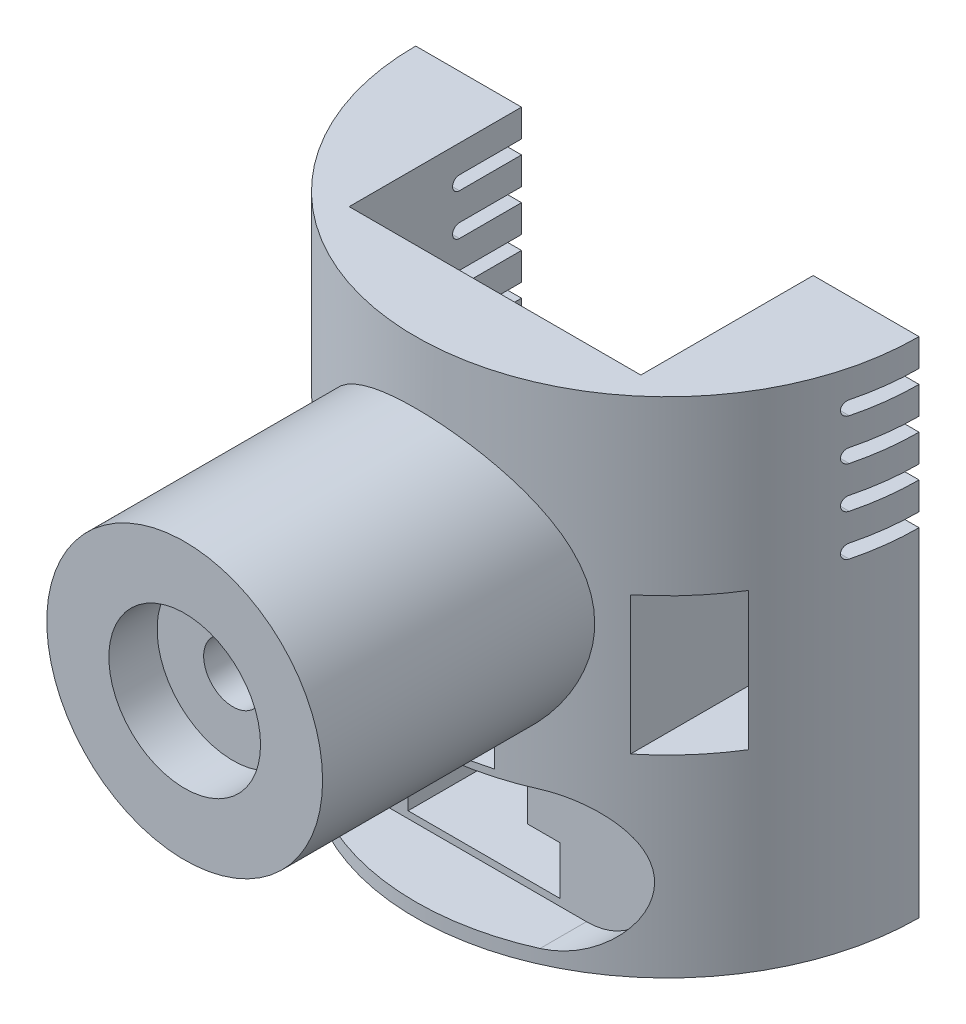
from build123d import *

# Parameters (mm, degrees)
SKETCH1_R                = 36.5
BOSS_EXTRUDE1_DEPTH      = 3
BOSS_EXTRUDE2_DEPTH      = 7
CUT_EXTRUDE1_REACH       = 54.091
SKETCH3_R                = 4.15
BOSS_EXTRUDE3_DEPTH      = 8
SKETCH5_R                = 36.5
BOSS_EXTRUDE4_DEPTH      = 5
SKETCH6_R                = 36.5
SKETCH6_W                = 42.3
SKETCH6_H                = 50
BOSS_EXTRUDE5_DEPTH      = 50
CUT_EXTRUDE3_DEPTH       = 12
BOSS_EXTRUDE7_REACH      = 136.177
BOSS_EXTRUDE7_END_RADIUS = 36.5
SKETCH11_R               = 20
SKETCH9_W                = 54.504938141
SKETCH9_H                = 78.124035864
CUT_REVOLVE1_ANGLE       = 180
SKETCH12_R               = 11
CUT_EXTRUDE4_DEPTH       = 7
CUT_EXTRUDE5_REACH       = 105.103
SKETCH13_R               = 4.25
CUT_EXTRUDE6_START       = -31
SKETCH14_R               = 11
CUT_EXTRUDE6_DEPTH       = 31
CUT_EXTRUDE7_REACH       = 106.337
CUT_EXTRUDE7_END_RADIUS  = 36.5
SKETCH16_W               = 8
SKETCH16_H               = 20
CUT_EXTRUDE8_REACH       = 106.337
SKETCH17_R               = 1.375
SKETCH18_W               = 20
SKETCH18_H               = 8.9
CUT_EXTRUDE9_DEPTH       = 15
CUT_EXTRUDE10_DEPTH      = 2.1
SKETCH20_W               = 10
SKETCH20_H               = 2
CUT_EXTRUDE11_DEPTH      = 125.73171226
FILLET1_R                = 1


with BuildPart() as part:
    # Sketch1 → Boss-Extrude1 (new body)
    with BuildSketch(Plane(origin=(0, 0, 0), x_dir=(1, 0, 0), z_dir=(0, 1, 0))):
        with Locations(Location((0, 0, 0), (0, 0, 270))):
            Circle(SKETCH1_R)
    extrude(amount=BOSS_EXTRUDE1_DEPTH)

    # Sketch2 → Boss-Extrude2 (add)
    with BuildSketch(Plane(origin=(0, 3, 0), x_dir=(1, 0, 0), z_dir=(0, 1, 0))):
        with BuildLine():
            Line((-11, 0), (-11, -34.803017111))
            ThreePointArc((-11, -34.803017111), (0, 36.5), (11, -34.803017111))
            Line((11, -34.803017111), (11, 0))
            ThreePointArc((11, 0), (0, 11), (-11, 0))
        make_face()
    extrude(amount=BOSS_EXTRUDE2_DEPTH)

    # Sketch3 → Cut-Extrude1 (cut, up to next)
    with BuildSketch(Plane(origin=(0, 3, 0), x_dir=(1, 0, 0), z_dir=(0, 1, 0)), mode=Mode.PRIVATE) as cut_extrude1_sk1:
        with Locations(Location((0, 0, 0), (0, 0, 270))):
            Circle(SKETCH3_R)
    cut_extrude1_tool1 = extrude(cut_extrude1_sk1.sketch, amount=-CUT_EXTRUDE1_REACH, mode=Mode.PRIVATE) & part.part
    add(cut_extrude1_tool1.solids().sort_by_distance((0, 3, 0))[0], mode=Mode.SUBTRACT)

    # Sketch4 → Boss-Extrude3 (add)
    with BuildSketch(Plane(origin=(0, 10, 0), x_dir=(1, 0, 0), z_dir=(0, 1, 0))):
        with BuildLine():
            Line((-11, -34.803017111), (-11, 0))
            ThreePointArc((-11, 0), (0, 11), (11, 0))
            Line((11, 0), (11, -34.803017111))
            ThreePointArc((11, -34.803017111), (0, 36.5), (-11, -34.803017111))
        make_face()
        with BuildLine():
            Line((-6.35, -35.943392995), (-6.35, -3.666174209))
            Line((-6.35, -3.666174209), (-6.35, 3.666174209))
            Line((-6.35, 3.666174209), (0, 7.332348419))
            Line((0, 7.332348419), (6.35, 3.666174209))
            Line((6.35, 3.666174209), (6.35, -3.666174209))
            Line((6.35, -3.666174209), (6.35, -35.943392995))
            ThreePointArc((6.35, -35.943392995), (8.693718381, -35.449531178), (11, -34.803017111))
            Line((11, -34.803017111), (11, 0))
            ThreePointArc((11, 0), (0, 11), (-11, 0))
            Line((-11, 0), (-11, -34.803017111))
            ThreePointArc((-11, -34.803017111), (-8.693718381, -35.449531178), (-6.35, -35.943392995))
        make_face()
    extrude(amount=BOSS_EXTRUDE3_DEPTH)

    # Sketch5 → Boss-Extrude4 (add)
    with BuildSketch(Plane(origin=(0, 18, 0), x_dir=(1, 0, 0), z_dir=(0, 1, 0))):
        with Locations(Location((0, 0, 0), (0, 0, 270))):
            Circle(SKETCH5_R)
    extrude(amount=BOSS_EXTRUDE4_DEPTH)

    # Sketch6 → Boss-Extrude5 (add)
    with BuildSketch(Plane(origin=(0, 23, 0), x_dir=(1, 0, 0), z_dir=(0, 1, 0))):
        with Locations(Location((0, 0, 0), (0, 0, 270))):
            Circle(SKETCH6_R)
        Rectangle(SKETCH6_W, SKETCH6_H, mode=Mode.SUBTRACT)
    extrude(amount=BOSS_EXTRUDE5_DEPTH)

    # Sketch7 → Cut-Extrude3 (cut)
    with BuildSketch(Plane(origin=(0, 0, 38.6), x_dir=(-1, 0, 0), z_dir=(0, 0, -1))):
        with BuildLine():
            Line((-14.866703783, 2), (14.866703783, 2))
            ThreePointArc((14.866703783, 2), (24.866703783, 12), (14.866703783, 22))
            Line((14.866703783, 22), (-14.866703783, 22))
            ThreePointArc((-14.866703783, 22), (-24.866703783, 12), (-14.866703783, 2))
        make_face()
    extrude(amount=CUT_EXTRUDE3_DEPTH, mode=Mode.SUBTRACT)

    # Boss-Extrude7: up to this cylinder (the profile starts outside it)
    boss_extrude7_end = Plane(origin=(0, 44, 0), z_dir=(0, -1, 0)) * Cylinder(BOSS_EXTRUDE7_END_RADIUS, 346.354, mode=Mode.PRIVATE)
    # Sketch11 → Boss-Extrude7 (add, up to the surface)
    with BuildSketch(Plane.XY.offset(70), mode=Mode.PRIVATE) as boss_extrude7_sk1:
        with Locations((0, 44)):
            Circle(SKETCH11_R)
    boss_extrude7_tool1 = extrude(boss_extrude7_sk1.sketch, amount=-BOSS_EXTRUDE7_REACH, mode=Mode.PRIVATE) - boss_extrude7_end
    add(boss_extrude7_tool1.solids().sort_by_distance((0, 44, 70))[0])

    # Sketch9 → Cut-Revolve1 (revolve, cut)
    with BuildSketch(Plane.XY):
        with Locations((27.252469071, 39.062017932)):
            Rectangle(SKETCH9_W, SKETCH9_H)
    revolve(axis=Axis((0, 0, 0), (0, 1, 0)), revolution_arc=CUT_REVOLVE1_ANGLE, mode=Mode.SUBTRACT)

    # Sketch12 → Cut-Extrude4 (cut)
    with BuildSketch(Plane.XY.offset(70)):
        with Locations((0, 44)):
            Circle(SKETCH12_R)
    extrude(amount=-CUT_EXTRUDE4_DEPTH, mode=Mode.SUBTRACT)

    # Sketch13 → Cut-Extrude5 (cut, up to next)
    with BuildSketch(Plane.XY.offset(63), mode=Mode.PRIVATE) as cut_extrude5_sk1:
        with Locations((0, 44)):
            Circle(SKETCH13_R)
    cut_extrude5_tool1 = extrude(cut_extrude5_sk1.sketch, amount=-CUT_EXTRUDE5_REACH, mode=Mode.PRIVATE) & part.part
    add(cut_extrude5_tool1.solids().sort_by_distance((0, 44, 63))[0], mode=Mode.SUBTRACT)

    # Sketch14 → Cut-Extrude6 (cut)
    with BuildSketch(Plane(origin=(0, 0, 25), x_dir=(-1, 0, 0), z_dir=(0, 0, -1)).offset(CUT_EXTRUDE6_START)):
        with Locations(Location((0, 44, 0), (0, 0, 180))):
            Circle(SKETCH14_R)
    extrude(amount=CUT_EXTRUDE6_DEPTH, mode=Mode.SUBTRACT)

    # Cut-Extrude7: up to this cylinder (the profile starts inside it)
    cut_extrude7_end = Plane(origin=(0, 38, 0), z_dir=(0, -1, 0)) * Cylinder(CUT_EXTRUDE7_END_RADIUS, 286.674, mode=Mode.PRIVATE)
    # Sketch16 → Cut-Extrude7 (cut, up to the surface)
    with BuildSketch(Plane.XY.offset(5), mode=Mode.PRIVATE) as cut_extrude7_sk1:
        with Locations((-27, 38)):
            Rectangle(SKETCH16_W, SKETCH16_H)
    cut_extrude7_tool1 = extrude(cut_extrude7_sk1.sketch, amount=CUT_EXTRUDE7_REACH, mode=Mode.PRIVATE) & cut_extrude7_end
    add(cut_extrude7_tool1.solids().sort_by_distance((-27, 38, 5))[0], mode=Mode.SUBTRACT)
    # Sketch16 → Cut-Extrude7 (cut, up to the surface)
    with BuildSketch(Plane.XY.offset(5), mode=Mode.PRIVATE) as cut_extrude7_sk2:
        with Locations((27, 38)):
            Rectangle(SKETCH16_W, SKETCH16_H)
    cut_extrude7_tool2 = extrude(cut_extrude7_sk2.sketch, amount=CUT_EXTRUDE7_REACH, mode=Mode.PRIVATE) & cut_extrude7_end
    add(cut_extrude7_tool2.solids().sort_by_distance((27, 38, 5))[0], mode=Mode.SUBTRACT)

    # Sketch17 → Cut-Extrude8 (cut, up to next)
    with BuildSketch(Plane.XY.offset(5), mode=Mode.PRIVATE) as cut_extrude8_sk1:
        with Locations((27, 42)):
            Circle(SKETCH17_R)
    cut_extrude8_tool1 = extrude(cut_extrude8_sk1.sketch, amount=-CUT_EXTRUDE8_REACH, mode=Mode.PRIVATE) & part.part
    # Sketch17 → Cut-Extrude8 (cut, up to next)
    with BuildSketch(Plane.XY.offset(5), mode=Mode.PRIVATE) as cut_extrude8_sk2:
        with Locations((27, 34)):
            Circle(SKETCH17_R)
    cut_extrude8_tool2 = extrude(cut_extrude8_sk2.sketch, amount=-CUT_EXTRUDE8_REACH, mode=Mode.PRIVATE) & part.part
    # Sketch17 → Cut-Extrude8 (cut, up to next)
    with BuildSketch(Plane.XY.offset(5), mode=Mode.PRIVATE) as cut_extrude8_sk3:
        with Locations((-27, 42)):
            Circle(SKETCH17_R)
    cut_extrude8_tool3 = extrude(cut_extrude8_sk3.sketch, amount=-CUT_EXTRUDE8_REACH, mode=Mode.PRIVATE) & part.part
    # Sketch17 → Cut-Extrude8 (cut, up to next)
    with BuildSketch(Plane.XY.offset(5), mode=Mode.PRIVATE) as cut_extrude8_sk4:
        with Locations((-27, 34)):
            Circle(SKETCH17_R)
    cut_extrude8_tool4 = extrude(cut_extrude8_sk4.sketch, amount=-CUT_EXTRUDE8_REACH, mode=Mode.PRIVATE) & part.part
    add(cut_extrude8_tool1.solids().sort_by_distance((27, 42, 5))[0], mode=Mode.SUBTRACT)
    add(cut_extrude8_tool2.solids().sort_by_distance((27, 34, 5))[0], mode=Mode.SUBTRACT)
    add(cut_extrude8_tool3.solids().sort_by_distance((-27, 42, 5))[0], mode=Mode.SUBTRACT)
    add(cut_extrude8_tool4.solids().sort_by_distance((-27, 34, 5))[0], mode=Mode.SUBTRACT)

    # Sketch18 → Cut-Extrude9 (cut)
    with BuildSketch(Plane(origin=(0, 0, 25), x_dir=(-1, 0, 0), z_dir=(0, 0, -1))):
        with Locations((0, 27.45)):
            Rectangle(SKETCH18_W, SKETCH18_H)
    extrude(amount=-CUT_EXTRUDE9_DEPTH, mode=Mode.SUBTRACT)

    # Sketch19 → Cut-Extrude10 (cut)
    with BuildSketch(Plane.XY.offset(5)):
        Polygon((-23.940043573, 42), (-25.470021787, 44.65), (-28.529978213, 44.65), (-30.059956427, 42), (-28.529978213, 39.35), (-25.470021787, 39.35), align=None)
        Polygon((-23.940043573, 34), (-25.470021787, 36.65), (-28.529978213, 36.65), (-30.059956427, 34), (-28.529978213, 31.35), (-25.470021787, 31.35), align=None)
        Polygon((30.059956427, 42), (28.529978213, 44.65), (25.470021787, 44.65), (23.940043573, 42), (25.470021787, 39.35), (28.529978213, 39.35), align=None)
        Polygon((30.059956427, 34), (28.529978213, 36.65), (25.470021787, 36.65), (23.940043573, 34), (25.470021787, 31.35), (28.529978213, 31.35), align=None)
    extrude(amount=-CUT_EXTRUDE10_DEPTH, mode=Mode.SUBTRACT)

    # Sketch20 → Cut-Extrude11 (cut, through all)
    with BuildSketch(Plane(origin=(36.5, 0, 0), x_dir=(0, 0, -1), z_dir=(1, 0, 0))):
        with Locations((-5, 68)):
            Rectangle(SKETCH20_W, SKETCH20_H)
        with Locations((-5, 62)):
            Rectangle(SKETCH20_W, SKETCH20_H)
        with Locations((-5, 56)):
            Rectangle(SKETCH20_W, SKETCH20_H)
        with Locations((-5, 50)):
            Rectangle(SKETCH20_W, SKETCH20_H)
    extrude(amount=-CUT_EXTRUDE11_DEPTH, mode=Mode.SUBTRACT)

    # Fillet1
    fillet1_edges = [part.edges().sort_by_distance(p)[0] for p in [
        (-28.126709318, 55, 10),
        (-28.126709318, 61, 10),
        (-28.126709318, 67, 10),
        (-28.126709318, 69, 10),
        (-28.126709318, 63, 10),
        (-28.126709318, 57, 10),
        (-28.126709318, 51, 10),
        (-28.126709318, 49, 10),
        (28.126709318, 51, 10),
        (28.126709318, 49, 10),
        (28.126709318, 55, 10),
        (28.126709318, 57, 10),
        (28.126709318, 63, 10),
        (28.126709318, 61, 10),
        (28.126709318, 69, 10),
        (28.126709318, 67, 10),
    ]]
    fillet(fillet1_edges, radius=FILLET1_R - 0.0001)  # a hair under: the kernel refuses the full size


solid = part.part
